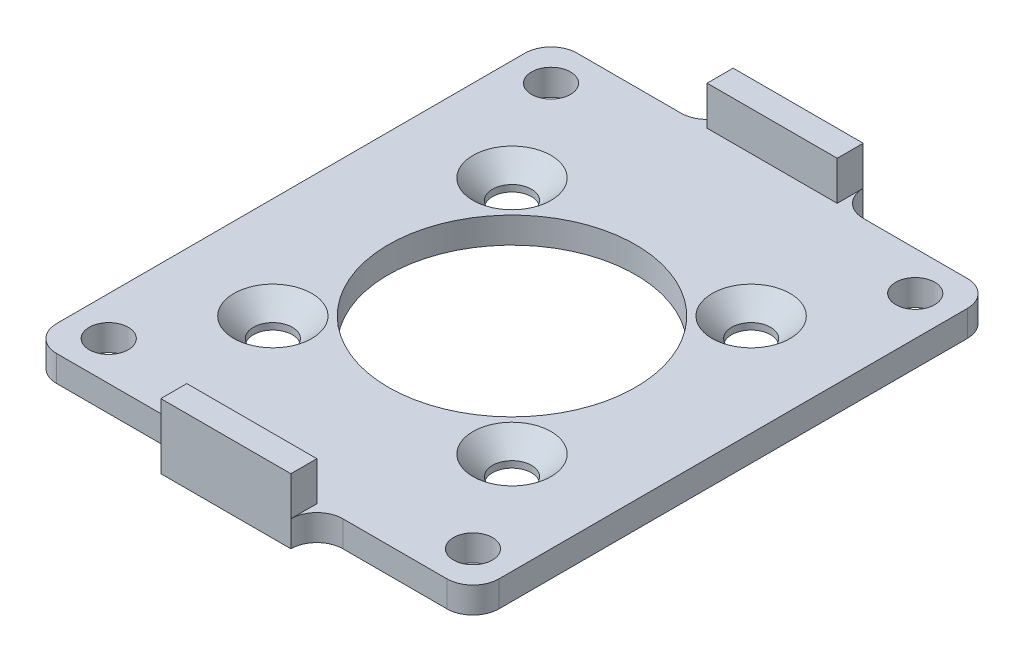
from build123d import *

# Parameters (mm, degrees)
SKETCH_1_W            = 34
SKETCH_1_H            = 40
SKETCH_1_R            = 9.5
SKETCH_1_R_2          = 1.5
EXTRUDE_1_DEPTH       = 2
HOLE_WIZARD_3_0_3_1_D = 3
FILLET_1_R            = 2
SKETCH_5_W            = 10
SKETCH_5_H            = 2
EXTRUDE_2_DEPTH       = 5
FILLET_2_R            = 2
CHAMFER_1_SIZE        = 1.5


with BuildPart() as part:
    # 草图1 → 凸台-拉伸1 (new body)
    with BuildSketch(Plane(origin=(0, 0, 0), x_dir=(1, 0, 0), z_dir=(0, 1, 0))):
        with Locations((17, 20)):
            Rectangle(SKETCH_1_W, SKETCH_1_H)
        with Locations(Location((17, 20, 0), (0, 0, 270))):
            Circle(SKETCH_1_R, mode=Mode.SUBTRACT)
        with Locations(Location((26.192388155, 29.192388155, 0), (0, 0, 270))):
            Circle(SKETCH_1_R_2, mode=Mode.SUBTRACT)
        with Locations(Location((7.807611845, 29.192388155, 0), (0, 0, 270))):
            Circle(SKETCH_1_R_2, mode=Mode.SUBTRACT)
        with Locations(Location((7.807611845, 10.807611845, 0), (0, 0, 270))):
            Circle(SKETCH_1_R_2, mode=Mode.SUBTRACT)
        with Locations(Location((26.192388155, 10.807611845, 0), (0, 0, 270))):
            Circle(SKETCH_1_R_2, mode=Mode.SUBTRACT)
    extrude(amount=EXTRUDE_1_DEPTH)

    # Ø3.0 (3) 直径孔1 (through all)
    with Locations(Plane(origin=(3, 2, -37), x_dir=(0, 0, 1), z_dir=(0, 1, 0))):
        with Locations((0, 0), (0, 28), (34, 28), (34, 0)):
            Hole(HOLE_WIZARD_3_0_3_1_D / 2)

    # 圆角1
    fillet_1_edges = [part.edges().sort_by_distance(p)[0] for p in [
        (0, 1, -40),
        (34, 1, -40),
        (34, 1, 0),
        (0, 1, 0),
    ]]
    fillet(fillet_1_edges, radius=FILLET_1_R)

    # 草图5 → 凸台-拉伸2 (add)
    with BuildSketch(Plane.XZ):
        with Locations((17, 1)):
            Rectangle(SKETCH_5_W, SKETCH_5_H)
        with Locations((17, -41)):
            Rectangle(SKETCH_5_W, SKETCH_5_H)
    extrude(amount=-EXTRUDE_2_DEPTH)

    # 圆角2
    fillet_2_edges = [part.edges().sort_by_distance(p)[0] for p in [
        (22, 1, -40),
        (12, 1, -40),
        (12, 1, 0),
        (22, 1, 0),
    ]]
    fillet(fillet_2_edges, radius=FILLET_2_R - 0.0001)  # a hair under: the kernel refuses the full size

    # 倒角1
    chamfer_1_edges = [part.edges().sort_by_distance(p)[0] for p in [
        (26.192388155, 2, -30.692388155),
        (7.807611845, 2, -30.692388155),
        (7.807611845, 2, -12.307611845),
        (26.192388155, 2, -12.307611845),
    ]]
    chamfer(chamfer_1_edges, length=CHAMFER_1_SIZE)


solid = part.part
